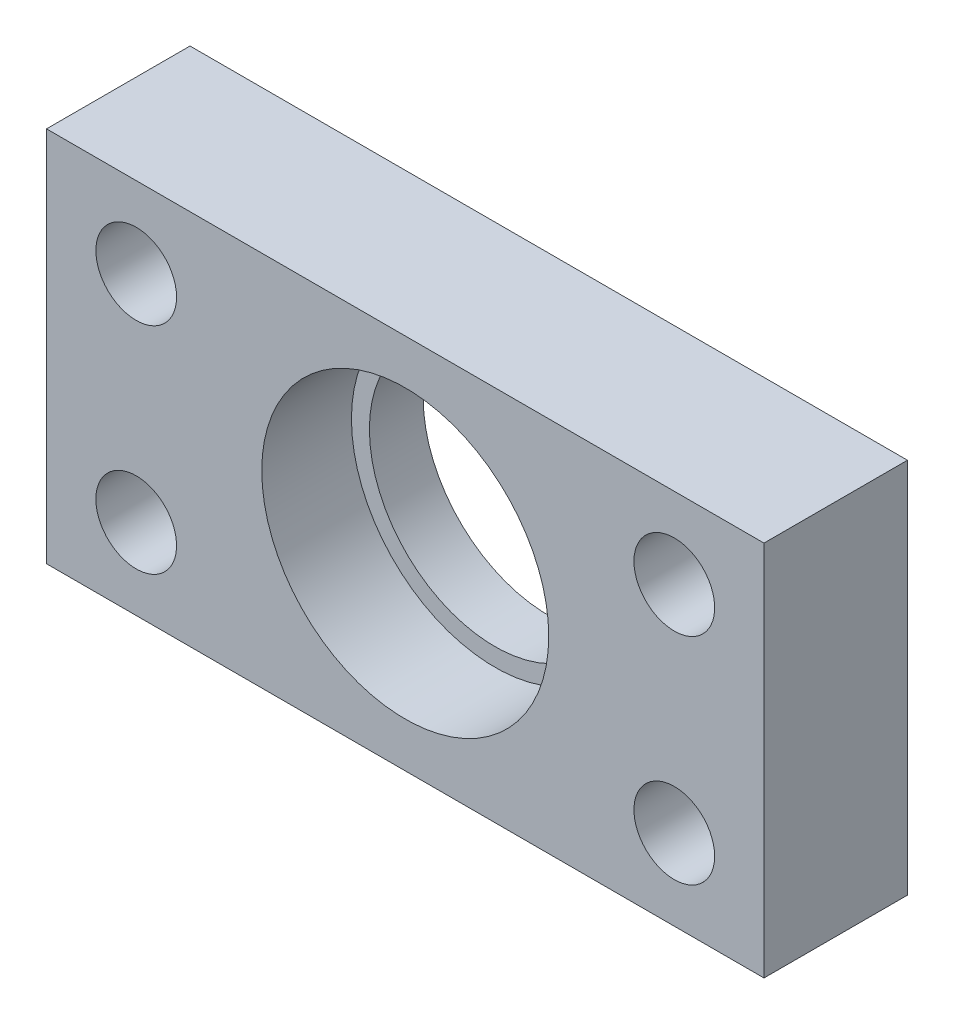
from build123d import *

# Parameters (mm, degrees)
ESQUISSE1_W             = 40
ESQUISSE1_H             = 21
BOSS_EXTRU_1_DEPTH      = 8
ESQUISSE2_R             = 8
ENL_V_MAT_EXTRU_1_DEPTH = 5
ESQUISSE3_R             = 7
ENL_V_MAT_EXTRU_2_DEPTH = 46.453272709
ESQUISSE5_R             = 2.25
ENL_V_MAT_EXTRU_4_DEPTH = 46.880278988


with BuildPart() as part:
    # Esquisse1 → Boss.-Extru.1 (new body)
    with BuildSketch(Plane.XY):
        with Locations((20, 10.5)):
            Rectangle(ESQUISSE1_W, ESQUISSE1_H)
    extrude(amount=BOSS_EXTRU_1_DEPTH)

    # Esquisse2 → Enlèv. mat.-Extru.1 (cut)
    with BuildSketch(Plane.XY.offset(8)):
        with Locations((20, 10.5)):
            Circle(ESQUISSE2_R)
    extrude(amount=-ENL_V_MAT_EXTRU_1_DEPTH, mode=Mode.SUBTRACT)

    # Esquisse3 → Enlèv. mat.-Extru.2 (cut, through all)
    with BuildSketch(Plane.XY.offset(3)):
        with Locations((20, 10.5)):
            Circle(ESQUISSE3_R)
    extrude(amount=-ENL_V_MAT_EXTRU_2_DEPTH, mode=Mode.SUBTRACT)

    # Esquisse5 → Enlèv. mat.-Extru.4 (cut, through all)
    with BuildSketch(Plane.XY.offset(8)):
        with Locations((5, 16.5)):
            Circle(ESQUISSE5_R)
        with Locations((5, 4.5)):
            Circle(ESQUISSE5_R)
        with Locations((35, 4.5)):
            Circle(ESQUISSE5_R)
        with Locations((35, 16.5)):
            Circle(ESQUISSE5_R)
    extrude(amount=-ENL_V_MAT_EXTRU_4_DEPTH, mode=Mode.SUBTRACT)


solid = part.part
